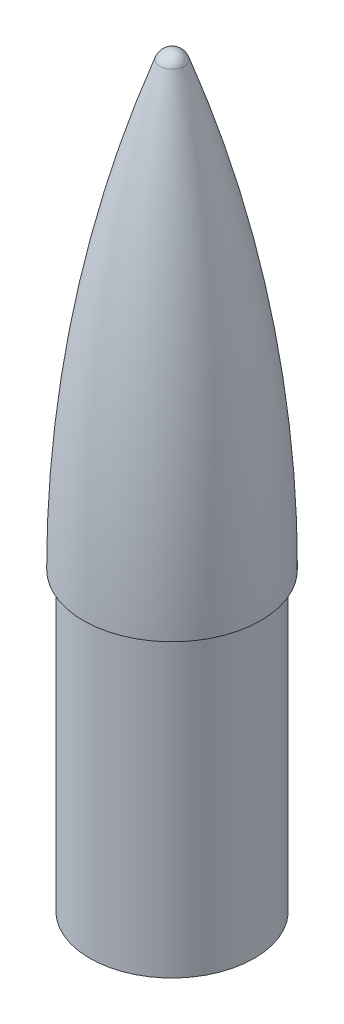
from build123d import *

# Parameters (mm, degrees)
SKETCH2_R          = 2.35
CUT_EXTRUDE1_DEPTH = 10


with BuildPart() as part:
    # Sketch1 → Revolve3 (revolve)
    with BuildSketch(Plane.XY):
        with BuildLine():
            Line((-20.555, 0), (-19.055, 0))
            Line((-19.055, 0), (-19.055, -68.554459216))
            Line((-19.055, -68.554459216), (-17.055, -68.554459216))
            Line((-17.055, -68.554459216), (-10, -68.554459216))
            Line((-10, -68.554459216), (-10, 71.445540784))
            Line((-10, 71.445540784), (0, 71.445540784))
            Line((0, 71.445540784), (0, 102.396949286))
            Line((0, 102.396949286), (0, 104.396949286))
            ThreePointArc((0, 104.396949286), (-1.728341267, 103.849057861), (-2.825386961, 102.405506928))
            ThreePointArc((-2.825386961, 102.405506928), (-16.08987064, 51.964475913), (-20.555, 0))
        make_face()
    revolve(axis=Axis((0, 102.396949286, 0), (0, 1, 0)))

    # Sketch2 → Cut-Extrude1 (cut)
    with BuildSketch(Plane.XZ.offset(68.554459216)):
        with Locations((0, -14.055)):
            Circle(SKETCH2_R)
        with Locations((0, 14.055)):
            Circle(SKETCH2_R)
    extrude(amount=-CUT_EXTRUDE1_DEPTH, mode=Mode.SUBTRACT)


solid = part.part
